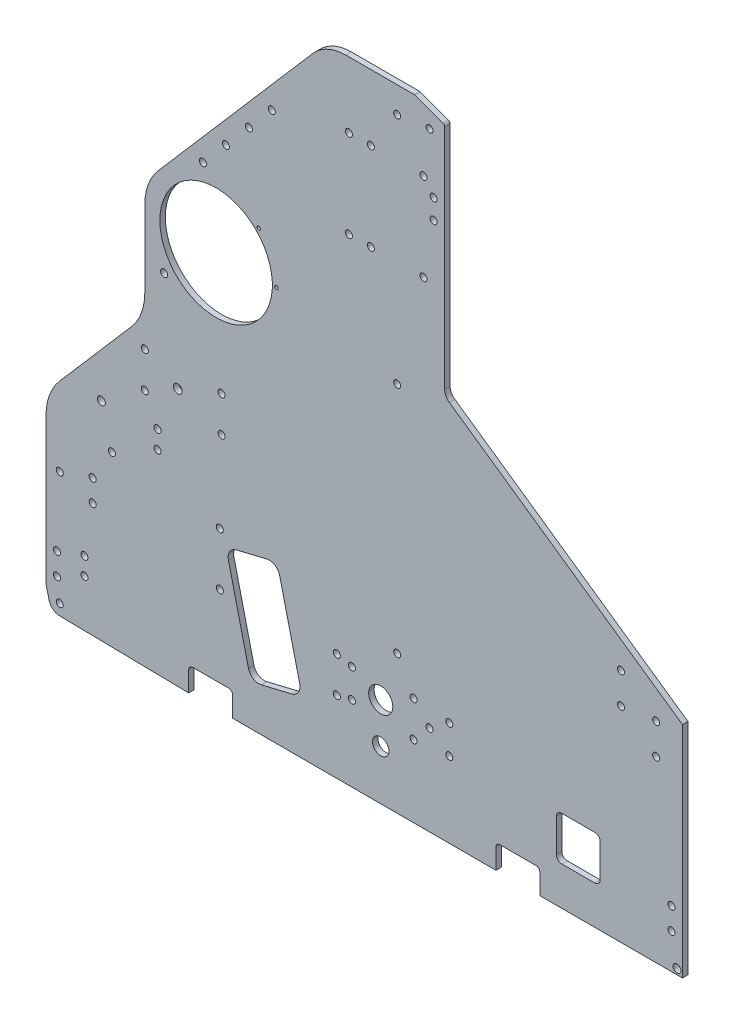
from build123d import *

# Parameters (mm, degrees)
SKETCH1_R           = 2.032
SKETCH1_R_2         = 2.54
SKETCH1_R_3         = 2
BOSS_EXTRUDE1_DEPTH = 3.175
FILLET1_R           = 2.286
FILLET2_R           = 6.35
SKETCH2_R           = 2.032
CUT_EXTRUDE1_DEPTH  = 505.524983177
FILLET3_R           = 1.5875
SKETCH3_R           = 2.032
SKETCH3_R_2         = 2.286
SKETCH3_R_3         = 1.016
CUT_EXTRUDE2_DEPTH  = 505.524983177
SKETCH4_R           = 2.032
SKETCH4_R_2         = 6.985
SKETCH4_R_3         = 4.7625
CUT_EXTRUDE3_DEPTH  = 505.524983177
SKETCH5_R           = 32.54375
SKETCH5_R_2         = 2.286000001
CUT_EXTRUDE5_DEPTH  = 540.282512236
FILLET4_R           = 31.75
CUT_EXTRUDE6_DEPTH  = 505.524983177
FILLET5_R           = 25.4
SKETCH8_R           = 2.032
CUT_EXTRUDE7_DEPTH  = 505.524983177


with BuildPart() as part:
    # Sketch1 → Boss-Extrude1 (new body)
    with BuildSketch(Plane.XY):
        with BuildLine():
            Line((7.829508682, -19.049081656), (82.55, -20.32))
            Line((82.55, -20.32), (82.55, -6.35))
            Line((82.55, -6.35), (107.95, -6.35))
            Line((107.95, -6.35), (107.95, -20.32))
            Line((107.95, -20.32), (260.35, -20.32))
            Line((260.35, -20.32), (260.35, -6.35))
            Line((260.35, -6.35), (285.75, -6.35))
            Line((285.75, -6.35), (285.75, -20.32))
            Line((285.75, -20.32), (368.3, -20.32))
            Line((368.3, -20.32), (368.3, 106.68))
            Line((368.3, 106.68), (230.66375, 202.565))
            Line((230.66375, 202.565), (230.66375, 338.455))
            Line((230.66375, 338.455), (213.19998, 344.805))
            Line((213.19998, 344.805), (203.2, 344.805))
            Line((203.2, 344.805), (161.925, 344.805))
            Line((161.925, 344.805), (52.720122664, 218.469945827))
            ThreePointArc((52.720122664, 218.469945827), (52.803835479, 218.142145922), (52.832, 217.805))
            ThreePointArc((52.832, 217.805), (52.095493096, 216.239521914), (50.419872403, 215.808871996))
            Line((50.419872403, 215.808871996), (0, 157.48))
            Line((0, 157.48), (0, 0))
            Line((0, 0), (0, -6.35))
            ThreePointArc((0, -6.35), (0.047577015, -7.125863724), (0.189595124, -7.890101219))
            Line((0.189595124, -7.890101219), (1.777095124, -14.240101219))
            ThreePointArc((1.777095124, -14.240101219), (3.987212552, -17.671692778), (7.829508682, -19.049081656))
        make_face()
        with Locations((7.9375, -12.7)):
            Circle(SKETCH1_R, mode=Mode.SUBTRACT)
        with Locations((6.35, 0)):
            Circle(SKETCH1_R, mode=Mode.SUBTRACT)
        with Locations((6.35, 12.7)):
            Circle(SKETCH1_R, mode=Mode.SUBTRACT)
        with Locations((38.1, 78.105)):
            Circle(SKETCH1_R, mode=Mode.SUBTRACT)
        with Locations((57.15, 118.58625)):
            Circle(SKETCH1_R, mode=Mode.SUBTRACT)
        with Locations((57.15, 139.22375)):
            Circle(SKETCH1_R, mode=Mode.SUBTRACT)
        with Locations((76.2, 128.905)):
            Circle(SKETCH1_R_2, mode=Mode.SUBTRACT)
        with Locations((101.6, 118.58625)):
            Circle(SKETCH1_R, mode=Mode.SUBTRACT)
        with Locations((101.6, 139.22375)):
            Circle(SKETCH1_R, mode=Mode.SUBTRACT)
        with Locations((203.2, 59.805)):
            Circle(SKETCH1_R_3, mode=Mode.SUBTRACT)
        with Locations((361.95, 0)):
            Circle(SKETCH1_R, mode=Mode.SUBTRACT)
        with Locations((361.95, 12.7)):
            Circle(SKETCH1_R, mode=Mode.SUBTRACT)
        with Locations((353.06, 82.955052336)):
            Circle(SKETCH1_R, mode=Mode.SUBTRACT)
        with Locations((332.74, 98.195052336)):
            Circle(SKETCH1_R, mode=Mode.SUBTRACT)
        with Locations((332.74, 115.975052336)):
            Circle(SKETCH1_R, mode=Mode.SUBTRACT)
        with Locations((353.06, 100.735052336)):
            Circle(SKETCH1_R, mode=Mode.SUBTRACT)
        with Locations((68.326, 182.923674932)):
            Circle(SKETCH1_R, mode=Mode.SUBTRACT)
        with Locations((76.2, 217.805)):
            Circle(SKETCH1_R, mode=Mode.SUBTRACT)
        with Locations((90.779500502, 249.682)):
            Circle(SKETCH1_R, mode=Mode.SUBTRACT)
        with Locations((104.067838673, 265.054783374)):
            Circle(SKETCH1_R, mode=Mode.SUBTRACT)
        with Locations((117.356176844, 280.427566748)):
            Circle(SKETCH1_R, mode=Mode.SUBTRACT)
        with Locations((130.644515014, 295.800350122)):
            Circle(SKETCH1_R, mode=Mode.SUBTRACT)
        with Locations((203.2, 194.805)):
            Circle(SKETCH1_R_3, mode=Mode.SUBTRACT)
        with Locations((224.31375, 287.401)):
            Circle(SKETCH1_R, mode=Mode.SUBTRACT)
        with Locations((224.31375, 298.831)):
            Circle(SKETCH1_R, mode=Mode.SUBTRACT)
        with Locations((203.2, 329.805)):
            Circle(SKETCH1_R_3, mode=Mode.SUBTRACT)
        with Locations((221.931865, 332.105)):
            Circle(SKETCH1_R_3, mode=Mode.SUBTRACT)
    extrude(amount=BOSS_EXTRUDE1_DEPTH)

    # Fillet1
    fillet1_edges = [part.edges().sort_by_distance(p)[0] for p in [
        (285.75, -6.35, 1.5875),
        (107.95, -6.35, 1.5875),
        (260.35, -6.35, 1.5875),
        (82.55, -6.35, 1.5875),
    ]]
    fillet(fillet1_edges, radius=FILLET1_R)

    # Fillet2
    fillet2_edges = [part.edges().sort_by_distance(p)[0] for p in [
        (230.66375, 202.565, 1.5875),
    ]]
    fillet(fillet2_edges, radius=FILLET2_R)

    # Sketch2 → Cut-Extrude1 (cut, through all)
    with BuildSketch(Plane(origin=(0, 0, 0), x_dir=(-1, 0, 0), z_dir=(0, 0, -1))):
        with Locations((-100.552770272, 71.086035298)):
            Circle(SKETCH2_R)
        with Locations((-100.552770272, 40.606035298)):
            Circle(SKETCH2_R)
        with Locations((-22.225, 18.202541089)):
            Circle(SKETCH2_R)
        with Locations((-22.225, 8.042541089)):
            Circle(SKETCH2_R)
    extrude(amount=-CUT_EXTRUDE1_DEPTH, mode=Mode.SUBTRACT)

    # Fillet3
    fillet3_edges = [part.edges().sort_by_distance(p)[0] for p in [
        (230.66375, 338.455, 1.5875),
        (213.19998, 344.805, 1.5875),
    ]]
    fillet(fillet3_edges, radius=FILLET3_R)

    # Sketch3 → Cut-Extrude2 (cut, through all)
    with BuildSketch(Plane.XY.offset(3.175)):
        with BuildLine():
            Line((127.789350211, 69.359774106), (110.090750339, 65.117184968))
            ThreePointArc((110.090750339, 65.117184968), (106.287939856, 62.356288953), (105.55119507, 57.715047577))
            Line((105.55119507, 57.715047577), (117.160037875, 9.287010566))
            ThreePointArc((117.160037875, 9.287010566), (119.92093389, 5.484200083), (124.562175266, 4.747455297))
            Line((124.562175266, 4.747455297), (142.260775137, 8.990044434))
            ThreePointArc((142.260775137, 8.990044434), (146.063585621, 11.75094045), (146.800330407, 16.392181825))
            Line((146.800330407, 16.392181825), (135.191487602, 64.820218836))
            ThreePointArc((135.191487602, 64.820218836), (132.430591586, 68.62302932), (127.789350211, 69.359774106))
        make_face()
        with Locations((26.987500002, 46.953113935)):
            Circle(SKETCH3_R)
        with Locations((26.987500002, 59.653113935)):
            Circle(SKETCH3_R)
        with Locations((7.937500002, 53.303113935)):
            Circle(SKETCH3_R)
        with Locations((32.030600739, 100.810868776)):
            Circle(SKETCH3_R_2)
        with Locations((64.525942114, 102.94048958)):
            Circle(SKETCH3_R)
        with Locations((64.525942114, 92.525786339)):
            Circle(SKETCH3_R)
        with Locations((133.35, 208.228121768)):
            Circle(SKETCH3_R_3)
        with Locations((123.120704333, 232.923826101)):
            Circle(SKETCH3_R_3)
    extrude(amount=-CUT_EXTRUDE2_DEPTH, mode=Mode.SUBTRACT)

    # Sketch4 → Cut-Extrude3 (cut, through all)
    with BuildSketch(Plane.XY.offset(3.175)):
        with Locations((168.275, 42.06875)):
            Circle(SKETCH4_R)
        with Locations((212.725, 42.06875)):
            Circle(SKETCH4_R)
        with Locations((212.725, 21.43125)):
            Circle(SKETCH4_R)
        with Locations((168.275, 21.43125)):
            Circle(SKETCH4_R)
        with Locations((193.675, 31.75)):
            Circle(SKETCH4_R_2)
        with Locations((177.00498, 40.0431)):
            Circle(SKETCH4_R)
        with Locations((177.00498, 23.4569)):
            Circle(SKETCH4_R)
        with Locations((193.675, 8.466666658)):
            Circle(SKETCH4_R_3)
        with Locations((221.931865, 31.75)):
            Circle(SKETCH4_R)
        with Locations((233.36123, 23.4569)):
            Circle(SKETCH4_R)
        with Locations((233.36123, 40.0431)):
            Circle(SKETCH4_R)
    extrude(amount=-CUT_EXTRUDE3_DEPTH, mode=Mode.SUBTRACT)

    # Sketch5 → Cut-Extrude5 (cut, through all)
    with BuildSketch(Plane(origin=(0, 0, -187.324999943), x_dir=(-1, 0, 0), z_dir=(0, 0, -1))):
        Polygon((0, 157.48), (-57.15, 223.594705882), (-57.15, 155.623527816), (0, 89.508821934), align=None)
        with Locations((-98.425, 208.228121768)):
            Circle(SKETCH5_R)
        with Locations((-365.124993903, -17.144956474)):
            Circle(SKETCH5_R_2)
    extrude(amount=-CUT_EXTRUDE5_DEPTH, mode=Mode.SUBTRACT)

    # Fillet4
    fillet4_edges = [part.edges().sort_by_distance(p)[0] for p in [
        (0, 89.508821934, 1.5875),
        (57.15, 155.623527816, 1.5875),
        (57.15, 223.594705882, 1.5875),
    ]]
    fillet(fillet4_edges, radius=FILLET4_R)

    # Sketch6 → Cut-Extrude6 (cut, through all)
    with BuildSketch(Plane.XY.offset(3.175)):
        with BuildLine():
            Line((298.45, 27.305), (317.5, 27.305))
            ThreePointArc((317.5, 27.305), (319.74506403, 26.37506403), (320.675, 24.13))
            Line((320.675, 24.13), (320.675, 5.08))
            ThreePointArc((320.675, 5.08), (319.74506403, 2.83493597), (317.5, 1.905))
            Line((317.5, 1.905), (298.45, 1.905))
            ThreePointArc((298.45, 1.905), (296.20493597, 2.83493597), (295.275, 5.08))
            Line((295.275, 5.08), (295.275, 24.13))
            ThreePointArc((295.275, 24.13), (296.20493597, 26.37506403), (298.45, 27.305))
        make_face()
    extrude(amount=-CUT_EXTRUDE6_DEPTH, mode=Mode.SUBTRACT)

    # Fillet5
    fillet5_edges = [part.edges().sort_by_distance(p)[0] for p in [
        (161.925, 344.805, 1.5875),
    ]]
    fillet(fillet5_edges, radius=FILLET5_R)

    # Sketch8 → Cut-Extrude7 (cut, through all)
    with BuildSketch(Plane(origin=(0, 0, 0), x_dir=(-1, 0, 0), z_dir=(0, 0, -1))):
        with Locations((-187.96, 306.704989017)):
            Circle(SKETCH8_R)
        with Locations((-175.26, 306.704989017)):
            Circle(SKETCH8_R)
        with Locations((-218.44, 306.704988609)):
            Circle(SKETCH8_R)
        with Locations((-218.44, 255.904988609)):
            Circle(SKETCH8_R)
        with Locations((-187.96, 255.904989017)):
            Circle(SKETCH8_R)
        with Locations((-175.26, 255.904989017)):
            Circle(SKETCH8_R)
    extrude(amount=-CUT_EXTRUDE7_DEPTH, mode=Mode.SUBTRACT)


solid = part.part
